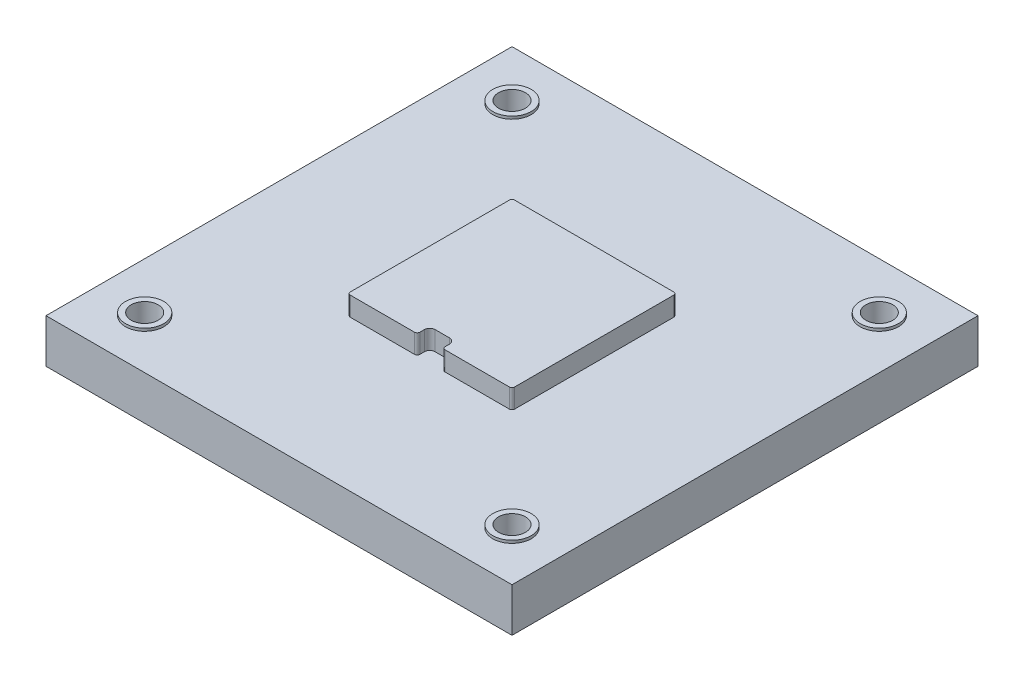
from build123d import *

# Parameters (mm, degrees)
SKETCH1_W           = 85
SKETCH1_H           = 85
SKETCH1_R           = 2.4575
BOSS_EXTRUDE1_DEPTH = 8
SKETCH2_R           = 3.969
CUT_EXTRUDE1_DEPTH  = 4.166
SKETCH3_R           = 3.5
SKETCH3_R_2         = 2.4575
BOSS_EXTRUDE2_DEPTH = 0.5
BOSS_EXTRUDE3_DEPTH = 3.5


with BuildPart() as part:
    # Sketch1 → Boss-Extrude1 (new body)
    with BuildSketch(Plane(origin=(0, 0, 0), x_dir=(1, 0, 0), z_dir=(0, 1, 0))):
        Rectangle(SKETCH1_W, SKETCH1_H)
        with Locations((-33.5, 33.5)):
            Circle(SKETCH1_R, mode=Mode.SUBTRACT)
        with Locations((-33.5, -33.5)):
            Circle(SKETCH1_R, mode=Mode.SUBTRACT)
        with Locations((33.5, -33.5)):
            Circle(SKETCH1_R, mode=Mode.SUBTRACT)
        with Locations((33.5, 33.5)):
            Circle(SKETCH1_R, mode=Mode.SUBTRACT)
    extrude(amount=BOSS_EXTRUDE1_DEPTH)

    # Sketch2 → Cut-Extrude1 (cut)
    with BuildSketch(Plane.XZ):
        with Locations((-33.5, 33.5)):
            Circle(SKETCH2_R)
        with Locations((33.5, 33.5)):
            Circle(SKETCH2_R)
        with Locations((33.5, -33.5)):
            Circle(SKETCH2_R)
        with Locations((-33.5, -33.5)):
            Circle(SKETCH2_R)
    extrude(amount=-CUT_EXTRUDE1_DEPTH, mode=Mode.SUBTRACT)

    # Sketch3 → Boss-Extrude2 (add)
    # profile 1 of 4: a face of its own
    with BuildSketch(Plane(origin=(0, 8, 0), x_dir=(1, 0, 0), z_dir=(0, 1, 0))):
        with Locations((33.5, -33.5)):
            Circle(SKETCH3_R)
        with Locations((33.5, -33.5)):
            Circle(SKETCH3_R_2, mode=Mode.SUBTRACT)
    # profile 2 of 4: a face of its own
    with BuildSketch(Plane(origin=(0, 8, 0), x_dir=(1, 0, 0), z_dir=(0, 1, 0))):
        with Locations((-33.5, -33.5)):
            Circle(SKETCH3_R)
        with Locations((-33.5, -33.5)):
            Circle(SKETCH3_R_2, mode=Mode.SUBTRACT)
    # profile 3 of 4: a face of its own
    with BuildSketch(Plane(origin=(0, 8, 0), x_dir=(1, 0, 0), z_dir=(0, 1, 0))):
        with Locations((-33.5, 33.5)):
            Circle(SKETCH3_R)
        with Locations((-33.5, 33.5)):
            Circle(SKETCH3_R_2, mode=Mode.SUBTRACT)
    # profile 4 of 4: a face of its own
    with BuildSketch(Plane(origin=(0, 8, 0), x_dir=(1, 0, 0), z_dir=(0, 1, 0))):
        with Locations((33.5, 33.5)):
            Circle(SKETCH3_R)
        with Locations((33.5, 33.5)):
            Circle(SKETCH3_R_2, mode=Mode.SUBTRACT)
    extrude(amount=BOSS_EXTRUDE2_DEPTH)

    # Sketch4 → Boss-Extrude3 (add)
    with BuildSketch(Plane(origin=(0, 8, 0), x_dir=(1, 0, 0), z_dir=(0, 1, 0))):
        with BuildLine():
            Line((2.2929, -14.5), (2.2929, -13.7071))
            ThreePointArc((2.2929, -13.7071), (2.000006781, -12.999993219), (1.2929, -12.7071))
            Line((1.2929, -12.7071), (-1.2929, -12.7071))
            ThreePointArc((-1.2929, -12.7071), (-2.000006781, -12.999993219), (-2.2929, -13.7071))
            Line((-2.2929, -13.7071), (-2.2929, -14.5))
            ThreePointArc((-2.2929, -14.5), (-2.439346609, -14.853553391), (-2.7929, -15))
            Line((-2.7929, -15), (-14.5, -15))
            ThreePointArc((-14.5, -15), (-14.853553391, -14.853553391), (-15, -14.5))
            Line((-15, -14.5), (-15, 14.5))
            ThreePointArc((-15, 14.5), (-14.853553391, 14.853553391), (-14.5, 15))
            Line((-14.5, 15), (14.5, 15))
            ThreePointArc((14.5, 15), (14.853553391, 14.853553391), (15, 14.5))
            Line((15, 14.5), (15, -14.5))
            ThreePointArc((15, -14.5), (14.853553391, -14.853553391), (14.5, -15))
            Line((14.5, -15), (2.7929, -15))
            ThreePointArc((2.7929, -15), (2.439346609, -14.853553391), (2.2929, -14.5))
        make_face()
    extrude(amount=BOSS_EXTRUDE3_DEPTH)


solid = part.part
